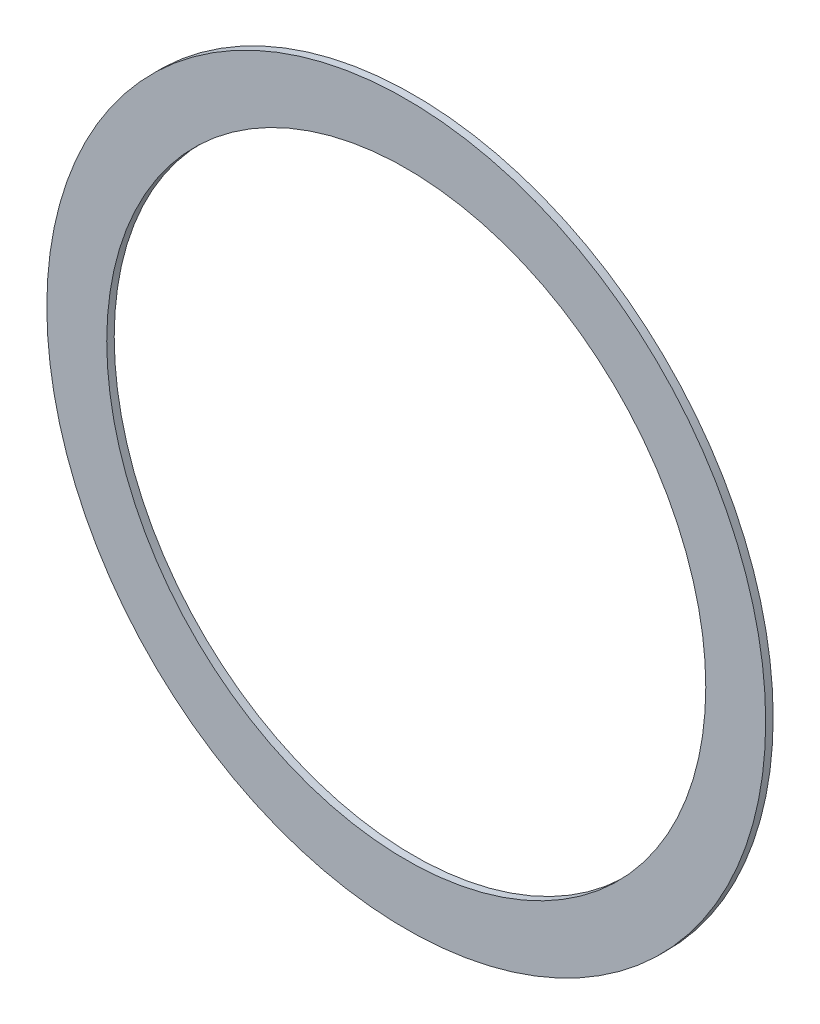
from build123d import *

# Parameters (mm, degrees)
SKETCH1_R           = 24
SKETCH1_R_2         = 20
BOSS_EXTRUDE1_DEPTH = 0.5


with BuildPart() as part:
    # Sketch1 → Boss-Extrude1 (new body)
    with BuildSketch(Plane.XY):
        Circle(SKETCH1_R)
        Circle(SKETCH1_R_2, mode=Mode.SUBTRACT)
    extrude(amount=BOSS_EXTRUDE1_DEPTH)


solid = part.part
